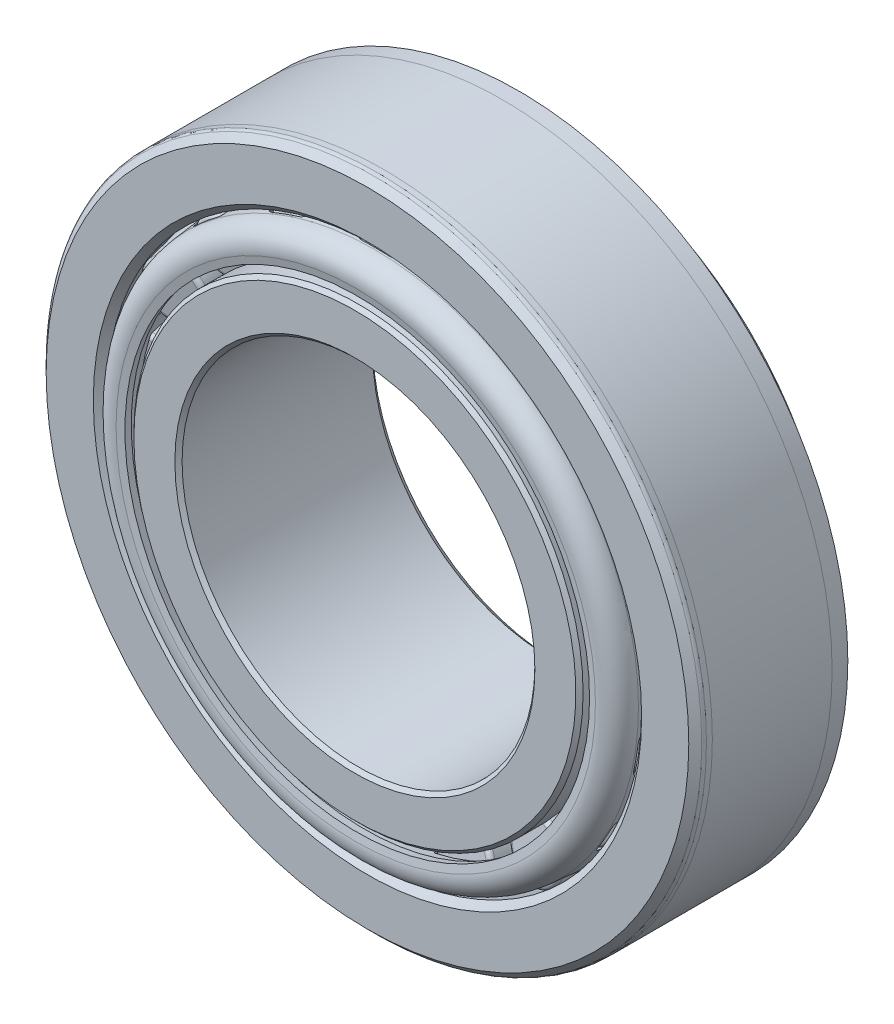
from build123d import *
from OCP.BRepFilletAPI import BRepFilletAPI_MakeChamfer

# Parameters (mm, degrees)
SKETCH8_R                 = 2.0675
CUT_EXTRUDE1_DEPTH        = 0.635
FILLET7_R                 = 0.9525
CHAMFER4_SIZE             = 0.516875
CHAMFER4_SIZE2            = 0.504815236
FILLET8_R                 = 0.5565
CIRPATTERN1_COUNT         = 18
FILLET9_R                 = 2.625
FILLET10_R                = 0.3315
FILLET11_R                = 0.371
CIRPATTERN2_COUNT         = 18
FILLET11_OF_CIRPATTERN2_R = 0.371
CHAMFER1_SIZE             = 0.990429687
CHAMFER1_SIZE2            = 0.829416014
FILLET6_R                 = 0.594257812
CHAMFER2_SIZE             = 0.455625
CHAMFER3_SIZE             = 0.932


with BuildPart() as part:
    # Sketch2 → Revolve1 (revolve)
    with BuildSketch(Plane(origin=(0, 0, 0), x_dir=(0, 0, -1), z_dir=(1, 0, 0)), mode=Mode.PRIVATE) as revolve1_sk:
        Polygon((-9.525, 41.4734375), (-9.525, 33.55), (9.525, 37.81), (9.525, 41.4734375), align=None)
    revolve(revolve1_sk.sketch.rotate(Axis((0, 0, 0), (0, 0, -1)), 90), axis=Axis((0, 0, 0), (0, 0, -1)))

    # Chamfer1: one chamfer whose edges measure the first distance from different faces: ONE call of the kernel's chamfer builder (chamfer() names one face for all edges)
    chamfer1_edges_1 = [part.edges().sort_by_distance(p)[0] for p in [
        (-33.55, 0, 9.525),
    ]]
    chamfer1_side_1 = [part.faces().sort_by_distance(p)[0] for p in [
        (-40.300391544, 0, 9.525),
    ]]
    chamfer1_edges_2 = [part.edges().sort_by_distance(p)[0] for p in [
        (-41.4734375, 0, 9.525),
    ]]
    chamfer1 = BRepFilletAPI_MakeChamfer(part.part.solid().wrapped)
    for e in chamfer1_edges_1:
        chamfer1.Add(CHAMFER1_SIZE, CHAMFER1_SIZE2, e.wrapped, chamfer1_side_1[0].wrapped)  # the first distance lies on this face
    for e in chamfer1_edges_2:
        chamfer1.Add(CHAMFER1_SIZE, e.wrapped)
    add(Compound.cast(chamfer1.Shape()), mode=Mode.REPLACE)

    # Fillet6
    fillet6_edges = [part.edges().sort_by_distance(p)[0] for p in [
        (-41.4734375, 0, 8.534570313),
    ]]
    fillet(fillet6_edges, radius=FILLET6_R)


with BuildPart() as body_2:
    # Sketch3 → Revolve2 (revolve)
    with BuildSketch(Plane(origin=(0, 0, 0), x_dir=(0, 0, -1), z_dir=(1, 0, 0)), mode=Mode.PRIVATE) as revolve2_sk:
        Polygon((-11.1125, 28.3), (-11.1125, 22.225), (14.2875, 22.225), (14.2875, 31.545), (9.776382219, 31.545), (10.184849514, 29.485779175), (-7.132058446, 26.484075709), (-7.492265411, 28.3), align=None)
    revolve(revolve2_sk.sketch.rotate(Axis((0, 0, 0), (0, 0, -1)), 90), axis=Axis((0, 0, 0), (0, 0, -1)))

    # Chamfer2
    chamfer2_edges = [body_2.edges().sort_by_distance(p)[0] for p in [
        (-22.225, 0, 11.1125),
        (-28.3, 0, 11.1125),
    ]]
    chamfer(chamfer2_edges, length=CHAMFER2_SIZE)

    # Chamfer3
    chamfer3_edges = [body_2.edges().sort_by_distance(p)[0] for p in [
        (-31.545, 0, -14.2875),
        (-22.225, 0, -14.2875),
    ]]
    chamfer(chamfer3_edges, length=CHAMFER3_SIZE)


with BuildPart() as body_3:
    # Sketch4 → Revolve3 (revolve)
    with BuildSketch(Plane(origin=(0, 0, 0), x_dir=(0, 0, -1), z_dir=(1, 0, 0)), mode=Mode.PRIVATE) as revolve3_sk:
        Polygon((14.0335, 34.719633394), (13.835039395, 35.72013996), (-11.55743081, 33.014588647), (-10.814809093, 29.270783146), (-9.814302527, 29.46924375), (-9.913532829, 29.969497033), align=None)
    revolve(revolve3_sk.sketch.rotate(Axis((0, 0, 0), (0, 0, -1)), 90), axis=Axis((0, 0, 0), (0, 0, -1)))

    # Fillet9
    fillet9_edges = [body_3.edges().sort_by_distance(p)[0] for p in [
        (-33.014588647, 0, 11.55743081),
    ]]
    fillet(fillet9_edges, radius=FILLET9_R)

    # Fillet10
    fillet10_edges = [body_3.edges().sort_by_distance(p)[0] for p in [
        (-35.72013996, 0, -13.835039395),
        (-34.719633394, 0, -14.0335),
    ]]
    fillet(fillet10_edges, radius=FILLET10_R)

    # Sketch9 → Cut-Revolve2 (revolve, cut)
    with BuildSketch(Plane(origin=(0, 0, 0), x_dir=(0, 0, -1), z_dir=(1, 0, 0))):
        Polygon((-7.853910254, 30.12317312), (9.380305788, 33.541754322), (10.239004236, 29.212767034), (-7.077903725, 26.211063568), align=None)
    cut_revolve2 = revolve(axis=Axis((0, 30.12317312, 7.853910254), (0, 0.19456922037173946, -0.9808887900694623)), mode=Mode.SUBTRACT)

    # Fillet11
    fillet11_edges = [body_3.edges().sort_by_distance(p)[0] for p in [
        (-3.567310367, 31.872646513, 8.20093601),
        (3.567310367, 31.872646513, 8.20093601),
        (4.354093776, 34.248648796, -9.240086113),
        (-4.354093776, 34.248648796, -9.240086113),
    ]]
    fillet(fillet11_edges, radius=FILLET11_R)

    # CirPattern2: Cut-Revolve2 ×18 about axis
    cirpattern2_axis = Axis((0, 0, 0), (0, 0, 1))
    for i in range(1, CIRPATTERN2_COUNT):
        add(cut_revolve2.rotate(cirpattern2_axis, i * 360 / CIRPATTERN2_COUNT), mode=Mode.SUBTRACT)

    # Fillet11 of CirPattern2
    fillet11_of_cirpattern2_edges = [body_3.edges().sort_by_distance(p)[0] for p in [
        (-14.253262357, 28.73039873, 8.20093601),
        (-7.5489119, 31.170582736, 8.20093601),
        (-7.622217978, 33.672390323, -9.240086113),
        (-15.805237562, 30.694014768, -9.240086113),
        (-23.22006055, 22.122840845, 8.20093601),
        (-17.754623983, 26.708886653, 8.20093601),
        (-18.679177753, 29.034744625, -9.240086113),
        (-25.350036437, 23.437229564, -9.240086113),
        (-29.38617675, 12.846941855, 8.20093601),
        (-25.818866382, 19.025704658, 8.20093601),
        (-27.483153015, 20.895080219, -9.240086113),
        (-31.837246791, 13.353568577, -9.240086113),
        (-32.007886339, 2.021512077, 8.20093601),
        (-30.768972451, 9.047741891, 8.20093601),
        (-32.972254415, 10.235160759, -9.240086113),
        (-34.484415314, 1.659270143, -9.240086113),
        (-30.768972451, -9.047741891, 8.20093601),
        (-32.007886339, -2.021512077, 8.20093601),
        (-34.484415314, -1.659270143, -9.240086113),
        (-32.972254415, -10.235160759, -9.240086113),
        (-25.818866382, -19.025704658, 8.20093601),
        (-29.38617675, -12.846941855, 8.20093601),
        (-31.837246791, -13.353568577, -9.240086113),
        (-27.483153015, -20.895080219, -9.240086113),
        (-17.754623983, -26.708886653, 8.20093601),
        (-23.22006055, -22.122840845, 8.20093601),
        (-25.350036437, -23.437229564, -9.240086113),
        (-18.679177753, -29.034744625, -9.240086113),
        (-7.5489119, -31.170582736, 8.20093601),
        (-14.253262357, -28.73039873, 8.20093601),
        (-15.805237562, -30.694014768, -9.240086113),
        (-7.622217978, -33.672390323, -9.240086113),
        (3.567310367, -31.872646513, 8.20093601),
        (-3.567310367, -31.872646513, 8.20093601),
        (-4.354093776, -34.248648796, -9.240086113),
        (4.354093776, -34.248648796, -9.240086113),
        (14.253262357, -28.73039873, 8.20093601),
        (7.5489119, -31.170582736, 8.20093601),
        (7.622217978, -33.672390323, -9.240086113),
        (15.805237562, -30.694014768, -9.240086113),
        (23.22006055, -22.122840845, 8.20093601),
        (17.754623983, -26.708886653, 8.20093601),
        (18.679177753, -29.034744625, -9.240086113),
        (25.350036437, -23.437229564, -9.240086113),
        (29.38617675, -12.846941855, 8.20093601),
        (25.818866382, -19.025704658, 8.20093601),
        (27.483153015, -20.895080219, -9.240086113),
        (31.837246791, -13.353568577, -9.240086113),
        (32.007886339, -2.021512077, 8.20093601),
        (30.768972451, -9.047741891, 8.20093601),
        (32.972254415, -10.235160759, -9.240086113),
        (34.484415314, -1.659270143, -9.240086113),
        (30.768972451, 9.047741891, 8.20093601),
        (32.007886339, 2.021512077, 8.20093601),
        (34.484415314, 1.659270143, -9.240086113),
        (32.972254415, 10.235160759, -9.240086113),
        (25.818866382, 19.025704658, 8.20093601),
        (29.38617675, 12.846941855, 8.20093601),
        (31.837246791, 13.353568577, -9.240086113),
        (27.483153015, 20.895080219, -9.240086113),
        (17.754623983, 26.708886653, 8.20093601),
        (23.22006055, 22.122840845, 8.20093601),
        (25.350036437, 23.437229564, -9.240086113),
        (18.679177753, 29.034744625, -9.240086113),
        (7.5489119, 31.170582736, 8.20093601),
        (14.253262357, 28.73039873, 8.20093601),
        (15.805237562, 30.694014768, -9.240086113),
        (7.622217978, 33.672390323, -9.240086113),
    ]]
    fillet(fillet11_of_cirpattern2_edges, radius=FILLET11_OF_CIRPATTERN2_R)


with BuildPart() as body_4:
    # Sketch6 → Revolve4 (revolve)
    with BuildSketch(Plane(origin=(0, 0, 0), x_dir=(0, 0, -1), z_dir=(1, 0, 0))):
        Polygon((10.184849514, 29.485779175), (9.380305788, 33.541754322), (-7.853910254, 30.12317312), (-7.132058446, 26.484075709), align=None)
    revolve(axis=Axis((0, 30.12317312, 7.853910254), (0, 0.19456922037173904, -0.9808887900694623)))

    # Sketch8 → Cut-Extrude1 (cut)
    with BuildSketch(Plane(origin=(0, 3.060034837, -15.426663393), x_dir=(-1, 0, 0), z_dir=(0, 0.19456922037173904, -0.9808887900694623))):
        with Locations(Location((0, 31.07561203, 0), (0, 0, 90))):
            Circle(SKETCH8_R)
    extrude(amount=-CUT_EXTRUDE1_DEPTH, mode=Mode.SUBTRACT)

    # Fillet7
    # the kernel refuses this fillet: 0.9525 mm, written as the material it adds along each edge
    with BuildSketch(Plane(origin=(0, 33.418202867, -8.757441406), x_dir=(0, 0.9808887900694623, 0.19456922037173943), z_dir=(-1, 0, 0))) as fillet7_piece_1:
        with BuildLine():
            CenterArc((1.169474388, 0.9525), FILLET7_R, 270, 70.528779366)
            Line((1.169474388, 0), (1.169474388, -0.01905))
            Line((1.169474388, -0.01905), (2.0675, -0.01905))
            Line((2.0675, -0.01905), (2.08655, 0))
            ThreePointArc((2.08655, 0), (2.08655, 0.3175), (2.085460512, 0.62865))
            Line((2.085460512, 0.62865), (2.0675, 0.635))
        make_face()
    revolve(axis=Axis((0, 33.418202867, -8.757441406), (0, 0.19456922037173904, -0.9808887900694623)))

    # Chamfer4
    chamfer4_edges = [body_4.edges().sort_by_distance(p)[0] for p in [
        (0, 37.597729469, -8.575762061),
    ]]
    chamfer4_side = [body_4.faces().sort_by_distance(p)[0] for p in [
        (0, 37.483009168, -8.598517994),
    ]]
    chamfer(chamfer4_edges, length=CHAMFER4_SIZE, length2=CHAMFER4_SIZE2, reference=chamfer4_side[0])

    # Fillet8
    fillet8_edges = [body_4.edges().sort_by_distance(p)[0] for p in [
        (0, 33.762270531, 8.575762061),
    ]]
    fillet(fillet8_edges, radius=FILLET8_R)


with BuildPart() as cirpattern1_1:
    # CirPattern1: pattern copy
    add(body_4.part.rotate(Axis((0, 0, 0), (0, 0, 1)), 1 * 360 / CIRPATTERN1_COUNT))


with BuildPart() as cirpattern1_2:
    # CirPattern1: pattern copy
    add(body_4.part.rotate(Axis((0, 0, 0), (0, 0, 1)), 2 * 360 / CIRPATTERN1_COUNT))


with BuildPart() as cirpattern1_3:
    # CirPattern1: pattern copy
    add(body_4.part.rotate(Axis((0, 0, 0), (0, 0, 1)), 3 * 360 / CIRPATTERN1_COUNT))


with BuildPart() as cirpattern1_4:
    # CirPattern1: pattern copy
    add(body_4.part.rotate(Axis((0, 0, 0), (0, 0, 1)), 4 * 360 / CIRPATTERN1_COUNT))


with BuildPart() as cirpattern1_5:
    # CirPattern1: pattern copy
    add(body_4.part.rotate(Axis((0, 0, 0), (0, 0, 1)), 5 * 360 / CIRPATTERN1_COUNT))


with BuildPart() as cirpattern1_6:
    # CirPattern1: pattern copy
    add(body_4.part.rotate(Axis((0, 0, 0), (0, 0, 1)), 6 * 360 / CIRPATTERN1_COUNT))


with BuildPart() as cirpattern1_7:
    # CirPattern1: pattern copy
    add(body_4.part.rotate(Axis((0, 0, 0), (0, 0, 1)), 7 * 360 / CIRPATTERN1_COUNT))


with BuildPart() as cirpattern1_8:
    # CirPattern1: pattern copy
    add(body_4.part.rotate(Axis((0, 0, 0), (0, 0, 1)), 8 * 360 / CIRPATTERN1_COUNT))


with BuildPart() as cirpattern1_9:
    # CirPattern1: pattern copy
    add(body_4.part.rotate(Axis((0, 0, 0), (0, 0, 1)), 9 * 360 / CIRPATTERN1_COUNT))


with BuildPart() as cirpattern1_10:
    # CirPattern1: pattern copy
    add(body_4.part.rotate(Axis((0, 0, 0), (0, 0, 1)), 10 * 360 / CIRPATTERN1_COUNT))


with BuildPart() as cirpattern1_11:
    # CirPattern1: pattern copy
    add(body_4.part.rotate(Axis((0, 0, 0), (0, 0, 1)), 11 * 360 / CIRPATTERN1_COUNT))


with BuildPart() as cirpattern1_12:
    # CirPattern1: pattern copy
    add(body_4.part.rotate(Axis((0, 0, 0), (0, 0, 1)), 12 * 360 / CIRPATTERN1_COUNT))


with BuildPart() as cirpattern1_13:
    # CirPattern1: pattern copy
    add(body_4.part.rotate(Axis((0, 0, 0), (0, 0, 1)), 13 * 360 / CIRPATTERN1_COUNT))


with BuildPart() as cirpattern1_14:
    # CirPattern1: pattern copy
    add(body_4.part.rotate(Axis((0, 0, 0), (0, 0, 1)), 14 * 360 / CIRPATTERN1_COUNT))


with BuildPart() as cirpattern1_15:
    # CirPattern1: pattern copy
    add(body_4.part.rotate(Axis((0, 0, 0), (0, 0, 1)), 15 * 360 / CIRPATTERN1_COUNT))


with BuildPart() as cirpattern1_16:
    # CirPattern1: pattern copy
    add(body_4.part.rotate(Axis((0, 0, 0), (0, 0, 1)), 16 * 360 / CIRPATTERN1_COUNT))


with BuildPart() as cirpattern1_17:
    # CirPattern1: pattern copy
    add(body_4.part.rotate(Axis((0, 0, 0), (0, 0, 1)), 17 * 360 / CIRPATTERN1_COUNT))


solid = Compound([part.part, body_2.part, body_3.part, body_4.part, cirpattern1_1.part, cirpattern1_2.part, cirpattern1_3.part, cirpattern1_4.part, cirpattern1_5.part, cirpattern1_6.part, cirpattern1_7.part, cirpattern1_8.part, cirpattern1_9.part, cirpattern1_10.part, cirpattern1_11.part, cirpattern1_12.part, cirpattern1_13.part, cirpattern1_14.part, cirpattern1_15.part, cirpattern1_16.part, cirpattern1_17.part])
